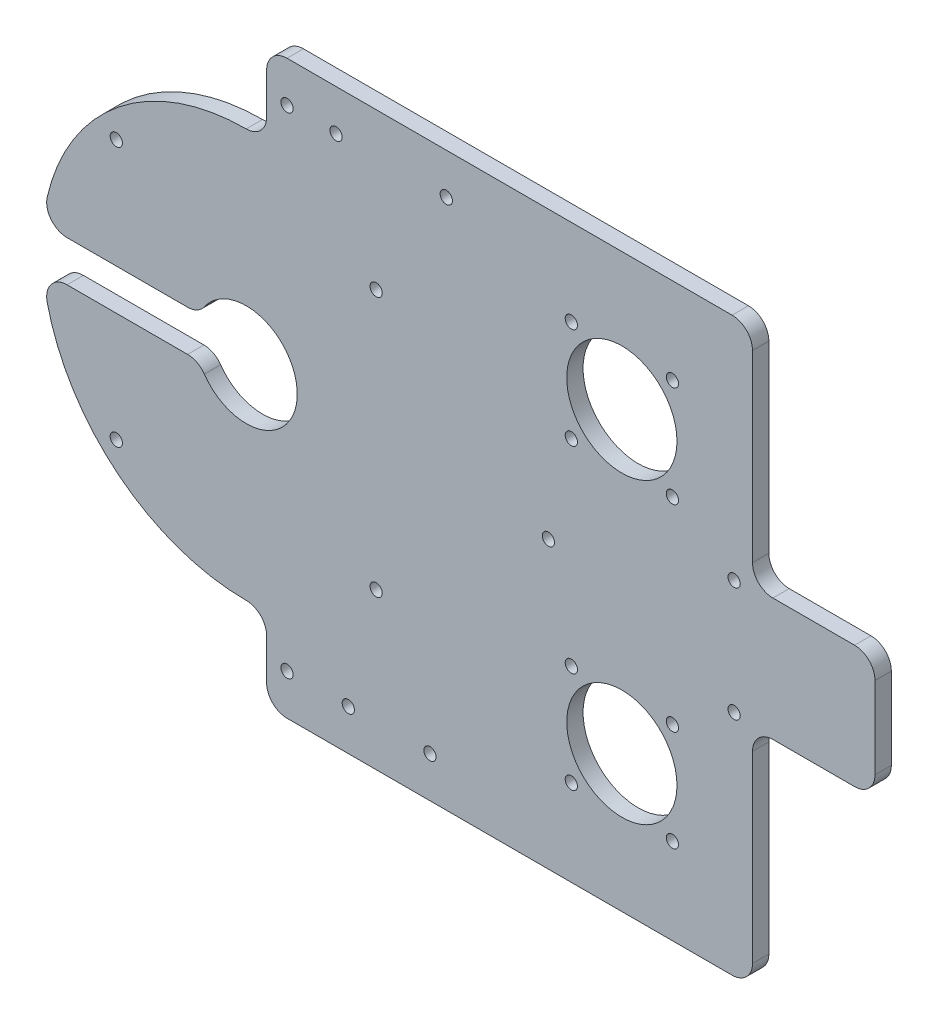
from build123d import *

# Parameters (mm, degrees)
SKETCH_1_W          = 110
SKETCH_1_H          = 100
SKETCH_1_W_2        = 30
SKETCH_1_H_2        = 30
EXTRUDE_1_DEPTH     = 4
FILLET_1_R          = 50
SKETCH_2_R          = 13.5
SKETCH_2_R_2        = 1.5
CUT_EXTRUDE_1_DEPTH = 4
SKETCH_4_W          = 55
SKETCH_4_H          = 20
EXTRUDE_2_DEPTH     = 4
FILLET_2_R          = 5
SKETCH_5_R          = 1.5
CUT_EXTRUDE_2_DEPTH = 4


with BuildPart() as part:
    # 草图1 → 凸台-拉伸1 (new body)
    with BuildSketch(Plane.XY):
        Rectangle(SKETCH_1_W, SKETCH_1_H)
        Polygon((55, 70), (55, 50), (55, -50), (55, -70), (119, -70), (119, -15), (119, 15), (119, 70), align=None)
        with Locations((134, 0)):
            Rectangle(SKETCH_1_W_2, SKETCH_1_H_2)
    extrude(amount=EXTRUDE_1_DEPTH)

    # 圆角1
    fillet_1_edges = [part.edges().sort_by_distance(p)[0] for p in [
        (-55, -50, 2),
        (-55, 50, 2),
    ]]
    fillet(fillet_1_edges, radius=FILLET_1_R - 0.0001)  # a hair under: the kernel refuses the full size

    # 草图2 → 切除-拉伸1 (cut)
    with BuildSketch(Plane.XY.offset(4)):
        with BuildLine():
            ThreePointArc((7.5, 0), (-2.446129454, 12.236328912), (-16.456439237, 5))
            Line((-16.456439237, 5), (-7.5, 5))
            Line((-7.5, 5), (-7.5, -5))
            Line((-7.5, -5), (-16.456439237, -5))
            ThreePointArc((-16.456439237, -5), (-2.446129454, -12.236328912), (7.5, 0))
        make_face()
        with BuildLine():
            Line((-7.5, 5), (-16.456439237, 5))
            ThreePointArc((-16.456439237, 5), (-17.5, 0), (-16.456439237, -5))
            Line((-16.456439237, -5), (-7.5, -5))
            Line((-7.5, -5), (-7.5, 5))
        make_face()
        with BuildLine():
            Line((-16.456439237, 5), (-27.5, 5))
            Line((-27.5, 5), (-27.5, -5))
            Line((-27.5, -5), (-16.456439237, -5))
            ThreePointArc((-16.456439237, -5), (-17.5, 0), (-16.456439237, 5))
        make_face()
        with Locations((87, 36.5)):
            Circle(SKETCH_2_R)
        with Locations((99.374368671, 24.125631329)):
            Circle(SKETCH_2_R_2)
        with Locations((74.625631329, 24.125631329)):
            Circle(SKETCH_2_R_2)
        with Locations((74.625631329, 48.874368671)):
            Circle(SKETCH_2_R_2)
        with Locations((99.374368671, 48.874368671)):
            Circle(SKETCH_2_R_2)
        with Locations((87, -36.5)):
            Circle(SKETCH_2_R)
        with Locations((74.625631329, -24.125631329)):
            Circle(SKETCH_2_R_2)
        with Locations((99.374368671, -24.125631329)):
            Circle(SKETCH_2_R_2)
        with Locations((99.374368671, -48.874368671)):
            Circle(SKETCH_2_R_2)
        with BuildLine():
            ThreePointArc((-55, 0), (-54.937303656, 2.503138753), (-54.749371855, 5))
            Line((-54.749371855, 5), (-85.65404948, 5))
            Line((-85.65404948, 5), (-85.65404948, -5))
            Line((-85.65404948, -5), (-54.749371855, -5))
            ThreePointArc((-54.749371855, -5), (-54.937303656, -2.503138753), (-55, 0))
        make_face()
        with BuildLine():
            Line((-27.5, -5), (-27.5, 5))
            Line((-27.5, 5), (-54.749371855, 5))
            ThreePointArc((-54.749371855, 5), (-54.937303656, 2.503138753), (-55, 0))
            ThreePointArc((-55, 0), (-54.937303656, -2.503138753), (-54.749371855, -5))
            Line((-54.749371855, -5), (-27.5, -5))
        make_face()
        with Locations((74.625631329, -48.874368671)):
            Circle(SKETCH_2_R_2)
    extrude(amount=-CUT_EXTRUDE_1_DEPTH, mode=Mode.SUBTRACT)

    # 草图4 → 凸台-拉伸2 (add)
    with BuildSketch(Plane.XY.offset(4)):
        with Locations((27.5, 60)):
            Rectangle(SKETCH_4_W, SKETCH_4_H)
        with Locations((27.5, -60)):
            Rectangle(SKETCH_4_W, SKETCH_4_H)
    extrude(amount=-EXTRUDE_2_DEPTH)

    # 圆角2
    fillet_2_edges = [part.edges().sort_by_distance(p)[0] for p in [
        (0, -70, 2),
        (119, -70, 2),
        (119, -15, 2),
        (149, -15, 2),
        (149, 15, 2),
        (119, 15, 2),
        (119, 70, 2),
        (0, 50, 2),
        (-54.749381402, 5, 2),
        (-16.456439237, 5, 2),
        (-16.456439237, -5, 2),
        (-54.749381402, -5, 2),
        (0, -50, 2),
        (0, 70, 2),
    ]]
    fillet(fillet_2_edges, radius=FILLET_2_R)

    # 草图5 → 切除-拉伸2 (cut)
    with BuildSketch(Plane.XY.offset(4)):
        with Locations((114.5, 14)):
            Circle(SKETCH_5_R)
        with Locations((114.5, -14)):
            Circle(SKETCH_5_R)
        with Locations((69, 0)):
            Circle(SKETCH_5_R)
        with Locations((-36.819805153, 31.819805153)):
            Circle(SKETCH_5_R)
        with Locations((26.819805153, 31.819805153)):
            Circle(SKETCH_5_R)
        with Locations((26.819805153, -31.819805153)):
            Circle(SKETCH_5_R)
        with Locations((-36.819805153, -31.819805153)):
            Circle(SKETCH_5_R)
        with Locations((5, -60)):
            Circle(SKETCH_5_R)
        with Locations((20, -60)):
            Circle(SKETCH_5_R)
        with Locations((40, -60)):
            Circle(SKETCH_5_R)
        with Locations((5, 60)):
            Circle(SKETCH_5_R)
        with Locations((17, 60)):
            Circle(SKETCH_5_R)
        with Locations((44, 60)):
            Circle(SKETCH_5_R)
    extrude(amount=-CUT_EXTRUDE_2_DEPTH, mode=Mode.SUBTRACT)


solid = part.part
